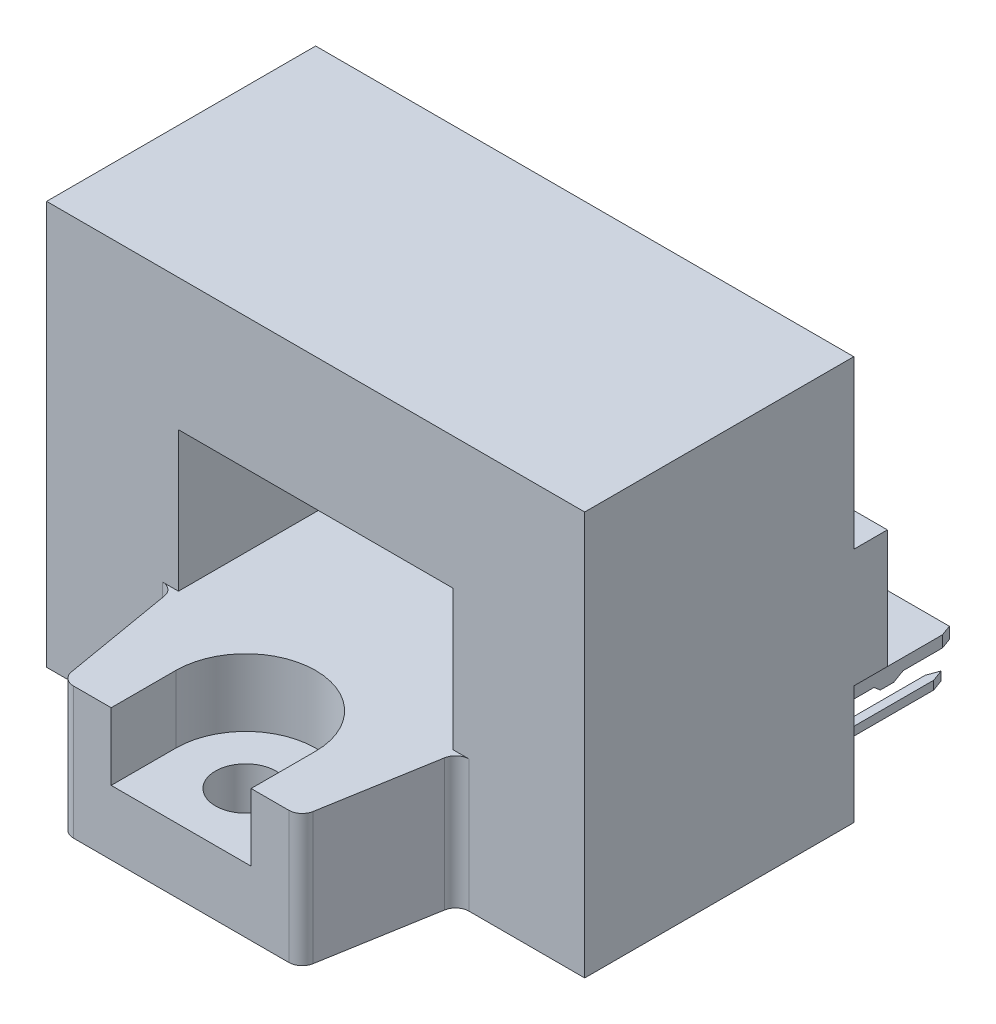
from build123d import *

# Parameters (mm, degrees)
SKETCH1_W                   = 40
SKETCH1_H                   = 30
SKETCH1_W_2                 = 20.4
SKETCH1_H_2                 = 10.4
BOSS_EXTRUDE1_DEPTH         = 20
BOSS_EXTRUDE2_DEPTH         = 9.8
CUT_EXTRUDE1_DEPTH          = 5
SKETCH4_R                   = 2.25
CUT_EXTRUDE2_DEPTH          = 56.991427915
SKETCH5_W                   = 8.8
SKETCH5_H                   = 8.8
SKETCH5_W_2                 = 20.4
SKETCH5_H_2                 = 10.4
BOSS_EXTRUDE3_DEPTH         = 2.5
SKETCH7_R                   = 1.25
BOSS_EXTRUDE4_DEPTH         = 3
BODY_MOVE_COPY6_START       = 1
BODY_MOVE_COPY6_DEPTH       = 4.9
BODY_MOVE_COPY6_START_2     = 5.95
BODY_MOVE_COPY6_2_DEPTH     = 0.85
BODY_MOVE_COPY6_START_3     = 3.8825
BODY_MOVE_COPY6_3_DEPTH     = 0.635
BODY_MOVE_COPY6_4_OUTLINE_W = 0.75
BODY_MOVE_COPY6_4_OUTLINE_H = 1
BODY_MOVE_COPY6_4_DEPTH     = 2.35
BODY_MOVE_COPY6_START_4     = 4.6
BODY_MOVE_COPY6_5_OUTLINE_W = 0.75
BODY_MOVE_COPY6_5_OUTLINE_H = 1
BODY_MOVE_COPY6_5_DEPTH     = 1.35
BODY_MOVE_COPY6_START_5     = 30.5
BODY_MOVE_COPY6_6_DEPTH     = 7.5
BODY_MOVE_COPY6_START_6     = 29.5
BODY_MOVE_COPY6_7_DEPTH     = 9.5


with BuildPart() as part:
    # Sketch1 → Boss-Extrude1 (new body)
    with BuildSketch(Plane.XY):
        with Locations((20, 15)):
            Rectangle(SKETCH1_W, SKETCH1_H)
        with Locations((20, 15)):
            Rectangle(SKETCH1_W_2, SKETCH1_H_2, mode=Mode.SUBTRACT)
    extrude(amount=BOSS_EXTRUDE1_DEPTH)

    # Sketch2 → Boss-Extrude2 (add)
    with BuildSketch(Plane.XZ):
        with BuildLine():
            Line((8.6, 20), (31.4, 20))
            ThreePointArc((31.4, 20), (30.755366169, 20.23550851), (30.414365834, 20.831105526))
            Line((30.414365834, 20.831105526), (28.985634166, 29.168894474))
            ThreePointArc((28.985634166, 29.168894474), (28.644633831, 29.76449149), (28, 30))
            Line((28, 30), (12, 30))
            ThreePointArc((12, 30), (11.355366169, 29.76449149), (11.014365834, 29.168894474))
            Line((11.014365834, 29.168894474), (9.585634166, 20.831105526))
            ThreePointArc((9.585634166, 20.831105526), (9.244633831, 20.23550851), (8.6, 20))
        make_face()
    extrude(amount=-BOSS_EXTRUDE2_DEPTH)

    # Sketch3 → Cut-Extrude1 (cut)
    with BuildSketch(Plane(origin=(0, 9.8, 0), x_dir=(1, 0, 0), z_dir=(0, 1, 0))):
        with BuildLine():
            Line((25.2, -25.2), (25.2, -30))
            Line((25.2, -30), (14.8, -30))
            Line((14.8, -30), (14.8, -25.2))
            ThreePointArc((14.8, -25.2), (20, -20), (25.2, -25.2))
        make_face()
    extrude(amount=-CUT_EXTRUDE1_DEPTH, mode=Mode.SUBTRACT)

    # Sketch4 → Cut-Extrude2 (cut, through all)
    with BuildSketch(Plane(origin=(0, 4.8, 0), x_dir=(1, 0, 0), z_dir=(0, 1, 0))):
        with Locations(Location((20, -25.2, 0), (0, 0, 270))):
            Circle(SKETCH4_R)
    extrude(amount=-CUT_EXTRUDE2_DEPTH, mode=Mode.SUBTRACT)

    # Sketch5 → Boss-Extrude3 (add)
    # profile 1 of 3: a face of its own
    with BuildSketch(Plane(origin=(0, 0, 0), x_dir=(-1, 0, 0), z_dir=(0, 0, -1))):
        with Locations((-4.4, 13.2)):
            Rectangle(SKETCH5_W, SKETCH5_H)
    # profile 2 of 3: a face of its own
    with BuildSketch(Plane(origin=(0, 0, 0), x_dir=(-1, 0, 0), z_dir=(0, 0, -1))):
        Polygon((-31.2, 8.8), (-8.8, 8.8), (-8.8, 17.6), (-8.8, 21.2), (-31.2, 21.2), (-31.2, 17.6), align=None)
        with Locations((-20, 15)):
            Rectangle(SKETCH5_W_2, SKETCH5_H_2, mode=Mode.SUBTRACT)
    # profile 3 of 3: a face of its own
    with BuildSketch(Plane(origin=(0, 0, 0), x_dir=(-1, 0, 0), z_dir=(0, 0, -1))):
        with Locations((-35.6, 13.2)):
            Rectangle(SKETCH5_W, SKETCH5_H)
    extrude(amount=BOSS_EXTRUDE3_DEPTH)

    # Sketch7 → Boss-Extrude4 (add)
    with BuildSketch(Plane.XZ):
        with Locations(Location((20, 5, 0), (0, 0, 90))):
            Circle(SKETCH7_R)
    extrude(amount=BOSS_EXTRUDE4_DEPTH)


with BuildPart() as body_2:
    # Body-Move/Copy6: read off the stored shape, not the designer's step
    # Body-Move/Copy6 outline → Body-Move/Copy6 (new body)
    with BuildSketch(Plane(origin=(0, 0, 0), x_dir=(1, 0, 0), z_dir=(0, 1, 0)).offset(BODY_MOVE_COPY6_START)):
        Polygon((34.75, -1.3), (36.25, -1.3), (36.25, -2.3), (37.25, -2.3), (37.25, -1.3), (38.75, -1.3), (38.75, -2.3), (39, -2.3), (39, 1), (37.125, 1), (37.125, 0), (36.375, 0), (36.375, 1), (34.625, 1), (34.625, 0), (33.875, 0), (33.875, 1), (32.125, 1), (32.125, 0), (31.375, 0), (31.375, 1), (29.5, 1), (29.5, -2.3), (29.75, -2.3), (29.75, -1.3), (31.25, -1.3), (31.25, -2.3), (32.25, -2.3), (32.25, -1.3), (33.75, -1.3), (33.75, -2.3), (34.75, -2.3), align=None)
    extrude(amount=BODY_MOVE_COPY6_DEPTH)

    # Body-Move_Copy6 2 outline → Body-Move_Copy6 2 (add)
    with BuildSketch(Plane(origin=(0, 0, 0), x_dir=(1, 0, 0), z_dir=(0, 1, 0)).offset(BODY_MOVE_COPY6_START_2)):
        Polygon((38, 1), (38, 8.6), (37.708823813, 9.4), (30.791176187, 9.4), (30.5, 8.6), (30.5, 1), align=None)
    extrude(amount=BODY_MOVE_COPY6_2_DEPTH)

    # Body-Move_Copy6 3 outline → Body-Move_Copy6 3 (add)
    with BuildSketch(Plane(origin=(0, 0, 0), x_dir=(1, 0, 0), z_dir=(0, 1, 0)).offset(BODY_MOVE_COPY6_START_3)):
        Polygon((35.1825, -4.827675919), (35.5, -5.7), (35.8175, -4.827675919), (35.8175, -1.3), (35.1825, -1.3), align=None)
        Polygon((38.3175, -1.3), (37.6825, -1.3), (37.6825, -4.827675919), (38, -5.7), (38.3175, -4.827675919), align=None)
        Polygon((33.3175, -4.827675919), (33.3175, -1.3), (32.6825, -1.3), (32.6825, -4.827675919), (33, -5.7), align=None)
        Polygon((38.3175, 1), (38.3175, 7.627675919), (38, 8.5), (37.6825, 7.627675919), (37.6825, 1), align=None)
        Polygon((30.8175, -4.827675919), (30.8175, -1.3), (30.1825, -1.3), (30.1825, -4.827675919), (30.5, -5.7), align=None)
        Polygon((35.1825, 1), (35.8175, 1), (35.8175, 7.627675919), (35.5, 8.5), (35.1825, 7.627675919), align=None)
        Polygon((30.1825, 7.627675919), (30.1825, 1), (30.8175, 1), (30.8175, 7.627675919), (30.5, 8.5), align=None)
        Polygon((32.6825, 1), (33.3175, 1), (33.3175, 7.627675919), (33, 8.5), (32.6825, 7.627675919), align=None)
    extrude(amount=BODY_MOVE_COPY6_3_DEPTH)

    # Body-Move_Copy6 4 outline → Body-Move_Copy6 4 (add)
    with BuildSketch(Plane(origin=(0, 0, 0), x_dir=(1, 0, 0), z_dir=(0, 1, 0)).offset(BODY_MOVE_COPY6_START)):
        with Locations((36.75, 0.5)):
            Rectangle(BODY_MOVE_COPY6_4_OUTLINE_W, BODY_MOVE_COPY6_4_OUTLINE_H)
        with Locations((34.25, 0.5)):
            Rectangle(BODY_MOVE_COPY6_4_OUTLINE_W, BODY_MOVE_COPY6_4_OUTLINE_H)
        with Locations((31.75, 0.5)):
            Rectangle(BODY_MOVE_COPY6_4_OUTLINE_W, BODY_MOVE_COPY6_4_OUTLINE_H)
    extrude(amount=BODY_MOVE_COPY6_4_DEPTH)

    # Body-Move_Copy6 5 outline → Body-Move_Copy6 5 (add)
    with BuildSketch(Plane(origin=(0, 0, 0), x_dir=(1, 0, 0), z_dir=(0, 1, 0)).offset(BODY_MOVE_COPY6_START_4)):
        with Locations((36.75, 0.5)):
            Rectangle(BODY_MOVE_COPY6_5_OUTLINE_W, BODY_MOVE_COPY6_5_OUTLINE_H)
        with Locations((34.25, 0.5)):
            Rectangle(BODY_MOVE_COPY6_5_OUTLINE_W, BODY_MOVE_COPY6_5_OUTLINE_H)
        with Locations((31.75, 0.5)):
            Rectangle(BODY_MOVE_COPY6_5_OUTLINE_W, BODY_MOVE_COPY6_5_OUTLINE_H)
    extrude(amount=BODY_MOVE_COPY6_5_DEPTH)

    # Body-Move_Copy6 6 outline → Body-Move_Copy6 6 (add)
    with BuildSketch(Plane.YZ.offset(BODY_MOVE_COPY6_START_5)):
        Polygon((5.95, -3.5), (5.55, -3.976701437), (5.55, -4.976701437), (5.95, -5.66952176), align=None)
        with BuildLine():
            Line((5.9, -1), (6.8, -1))
            Line((6.8, -1), (6.8, -0.6))
            ThreePointArc((6.8, -0.6), (6.536396103, 0.036396103), (5.9, 0.3))
            Line((5.9, 0.3), (5.9, -1))
        make_face()
    extrude(amount=BODY_MOVE_COPY6_6_DEPTH)

    # Body-Move_Copy6 7 outline → Body-Move_Copy6 7 (add)
    with BuildSketch(Plane.YZ.offset(BODY_MOVE_COPY6_START_6)):
        with BuildLine():
            Line((5.9, -1), (6.8, -1))
            Line((6.8, -1), (6.8, -0.6))
            ThreePointArc((6.8, -0.6), (6.536396103, 0.036396103), (5.9, 0.3))
            Line((5.9, 0.3), (5.9, -1))
        make_face()
    extrude(amount=BODY_MOVE_COPY6_7_DEPTH)


with BuildPart() as part_1:
    add(part.part)

    # Intersect3: read off the stored shape, not the designer's step
    # Intersect3: union body 2
    add(body_2.part)


solid = part_1.part
